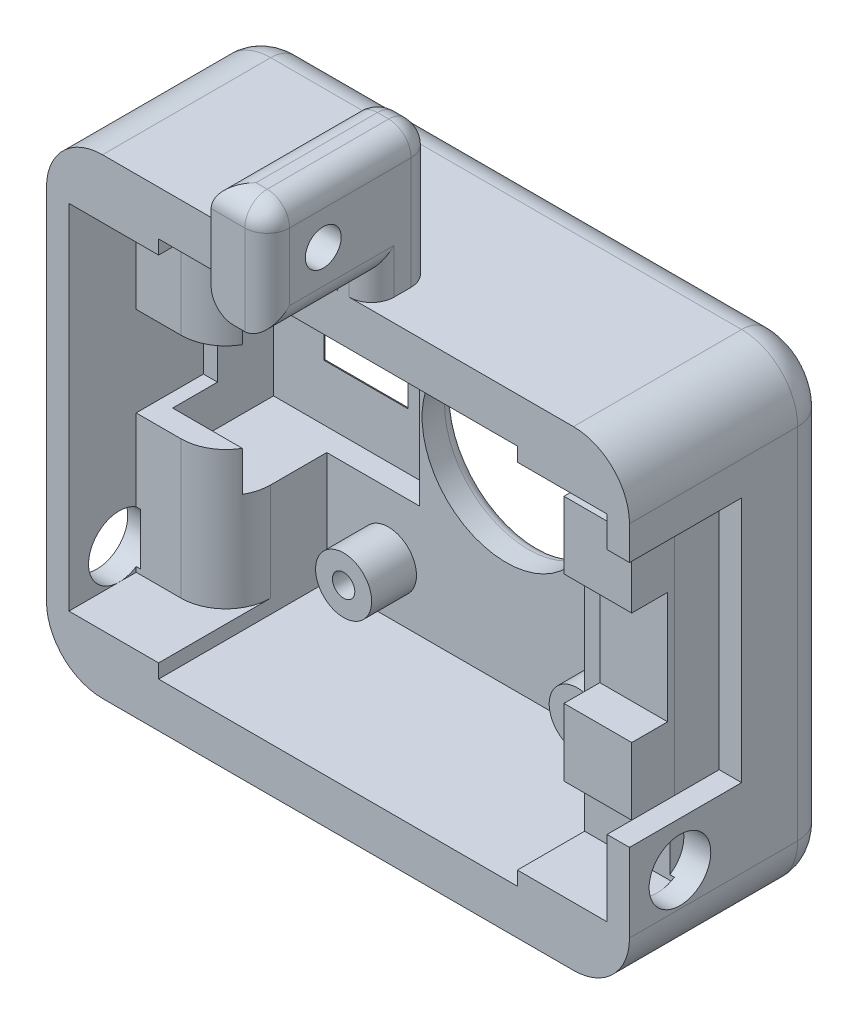
from build123d import *

# Parameters (mm, degrees)
SKETCH1_W               = 52
SKETCH1_H               = 42
BOSS_EXTRUDE1_DEPTH     = 10
SKETCH2_W               = 48
SKETCH2_H               = 31.5
CUT_EXTRUDE1_DEPTH      = 6
SKETCH6_W               = 52
SKETCH6_H               = 42
BOSS_EXTRUDE2_DEPTH     = 8
CUT_EXTRUDE5_DEPTH      = 36.510561809
CUT_EXTRUDE5_DEPTH_BACK = 9
SKETCH5_W               = 32
SKETCH5_H               = 34
CUT_EXTRUDE4_REACH      = 38.633
SKETCH7_R               = 7.5
FILLET2_R               = 1
FILLET3_R               = 3
FILLET4_R               = 5
SKETCH8_W               = 2
SKETCH8_H               = 22
CUT_EXTRUDE6_DEPTH      = 10
SKETCH11_W              = 6.046016102
SKETCH11_H              = 22
BOSS_EXTRUDE9_DEPTH     = 3.8
SKETCH12_W              = 7.5
SKETCH12_H              = 10
CUT_EXTRUDE8_DEPTH      = 3.2
FILLET9_R               = 4
SKETCH13_R              = 2.75
CUT_EXTRUDE9_DEPTH      = 2.4
CUT_EXTRUDE10_START     = -2.4
SKETCH14_R              = 2.75
CUT_EXTRUDE10_DEPTH     = 2.4
SKETCH18_W              = 15
SKETCH18_H              = 14
CUT_EXTRUDE15_DEPTH     = 9
SKETCH19_W              = 7.5
SKETCH19_H              = 4
CUT_EXTRUDE16_DEPTH     = 1
SKETCH21_W              = 5
SKETCH21_H              = 5.520077182
BOSS_EXTRUDE10_DEPTH    = 2
SKETCH27_W              = 5
SKETCH27_H              = 14.834345629
BOSS_EXTRUDE13_DEPTH    = 10
SKETCH28_R              = 1.6
CUT_EXTRUDE19_DEPTH     = 48.392414643
FILLET14_R              = 2
FILLET13_R              = 2
SKETCH25_R              = 2.5
BOSS_EXTRUDE12_DEPTH    = 4
SKETCH26_R              = 1
CUT_EXTRUDE18_DEPTH     = 4
SKETCH29_W              = 8
SKETCH29_H              = 8
CUT_EXTRUDE20_DEPTH     = 6
SKETCH30_W              = 26
SKETCH30_H              = 9
CUT_EXTRUDE21_DEPTH     = 2
CHAMFER1_SIZE           = 1


with BuildPart() as part:
    # Sketch1 → Boss-Extrude1 (new body)
    with BuildSketch(Plane.XY):
        Rectangle(SKETCH1_W, SKETCH1_H)
    extrude(amount=BOSS_EXTRUDE1_DEPTH)

    # Sketch2 → Cut-Extrude1 (cut)
    with BuildSketch(Plane.XY.offset(10)):
        Rectangle(SKETCH2_W, SKETCH2_H)
    extrude(amount=-CUT_EXTRUDE1_DEPTH, mode=Mode.SUBTRACT)

    # Sketch6 → Boss-Extrude2 (add)
    with BuildSketch(Plane(origin=(0, 0, 0), x_dir=(-1, 0, 0), z_dir=(0, 0, -1))):
        Rectangle(SKETCH6_W, SKETCH6_H)
    extrude(amount=BOSS_EXTRUDE2_DEPTH)

    # Sketch5 → Cut-Extrude5 (cut, two sides: drawn at the far end of the back side and taken through both)
    with BuildSketch(Plane.XY.offset(4).offset(-CUT_EXTRUDE5_DEPTH_BACK)):
        Rectangle(SKETCH5_W, SKETCH5_H)
    extrude(amount=CUT_EXTRUDE5_DEPTH + CUT_EXTRUDE5_DEPTH_BACK, mode=Mode.SUBTRACT)

    # Sketch7 → Cut-Extrude4 (cut, up to next)
    with BuildSketch(Plane.XY.offset(-5), mode=Mode.PRIVATE) as cut_extrude4_sk1:
        Circle(SKETCH7_R)
    cut_extrude4_tool1 = extrude(cut_extrude4_sk1.sketch, amount=-CUT_EXTRUDE4_REACH, mode=Mode.PRIVATE) & part.part
    add(cut_extrude4_tool1.solids().sort_by_distance((0, 0, -5))[0], mode=Mode.SUBTRACT)

    # Fillet2
    fillet2_edges = [part.edges().sort_by_distance(p)[0] for p in [
        (-7.5, 0, -8),
    ]]
    fillet(fillet2_edges, radius=FILLET2_R)

    # Fillet3
    fillet3_edges = [part.edges().sort_by_distance(p)[0] for p in [
        (-26, 0, -8),
        (0, 21, -8),
        (26, 0, -8),
        (0, -21, -8),
    ]]
    fillet(fillet3_edges, radius=FILLET3_R)

    # Fillet4
    # the kernel refuses this fillet: 5 mm, written as the material it takes off along each edge
    with BuildSketch(Plane(origin=(21, 16, -8), x_dir=(0, 1, 0), z_dir=(-1, 0, 0))) as fillet4_piece_1:
        with BuildLine():
            CenterArc((2, -3), 3, 0, 90)
            Line((5, -3), (5, 0))
            Line((5, 0), (2, 0))
        make_face()
    revolve(axis=Axis((21, 16, -8), (0, 0, -1)), revolution_arc=90, mode=Mode.SUBTRACT)
    with BuildSketch(Plane(origin=(-21, 16, -8), x_dir=(-1, 0, 0), z_dir=(0, -1, 0))) as fillet4_piece_2:
        with BuildLine():
            CenterArc((2, -3), 3, 0, 90)
            Line((5, -3), (5, 0))
            Line((5, 0), (2, 0))
        make_face()
    revolve(axis=Axis((-21, 16, -8), (0, 0, -1)), revolution_arc=90, mode=Mode.SUBTRACT)
    with BuildSketch(Plane(origin=(21, -16, -8), x_dir=(1, 0, 0), z_dir=(0, 1, 0))) as fillet4_piece_3:
        with BuildLine():
            CenterArc((2, -3), 3, 0, 90)
            Line((5, -3), (5, 0))
            Line((5, 0), (2, 0))
        make_face()
    revolve(axis=Axis((21, -16, -8), (0, 0, -1)), revolution_arc=90, mode=Mode.SUBTRACT)
    with BuildSketch(Plane(origin=(-21, -16, -8), x_dir=(0, -1, 0), z_dir=(1, 0, 0))) as fillet4_piece_4:
        with BuildLine():
            CenterArc((2, -3), 3, 0, 90)
            Line((5, -3), (5, 0))
            Line((5, 0), (2, 0))
        make_face()
    revolve(axis=Axis((-21, -16, -8), (0, 0, -1)), revolution_arc=90, mode=Mode.SUBTRACT)
    with BuildSketch(Plane(origin=(-26, 21, -8), x_dir=(0, -1, 0), z_dir=(0, 0, 1)), Plane(origin=(26, -21, 22.5), x_dir=(-1, 0, 0), z_dir=(0, 0, -1))) as fillet4_piece_5:
        with BuildLine():
            CenterArc((FILLET4_R, FILLET4_R), FILLET4_R, 180, 90)
            Line((0, FILLET4_R), (0, 0))
            Line((0, 0), (FILLET4_R, 0))
        make_face()
    extrude(amount=30.5, mode=Mode.SUBTRACT)
    with BuildSketch(Plane(origin=(-26, -21, -8), x_dir=(0, 1, 0), z_dir=(0, 0, 1)), Plane(origin=(26, 21, 22.5), x_dir=(-1, 0, 0), z_dir=(0, 0, -1))) as fillet4_piece_6:
        with BuildLine():
            CenterArc((FILLET4_R, -FILLET4_R), FILLET4_R, 90, 90)
            Line((0, -FILLET4_R), (0, 0))
            Line((0, 0), (FILLET4_R, 0))
        make_face()
    extrude(amount=30.5, mode=Mode.SUBTRACT)

    # Sketch8 → Cut-Extrude6 (cut)
    with BuildSketch(Plane.XY.offset(10)):
        with Locations((25, 2)):
            Rectangle(SKETCH8_W, SKETCH8_H)
    extrude(amount=-CUT_EXTRUDE6_DEPTH, mode=Mode.SUBTRACT)

    # Fillet9
    fillet9_edges = [part.edges().sort_by_distance(p)[0] for p in [
        (-16, 0, 4),
    ]]
    fillet(fillet9_edges, radius=FILLET9_R)

    # Sketch13 → Cut-Extrude9 (cut)
    with BuildSketch(Plane(origin=(26, 0, 0), x_dir=(0, 0, -1), z_dir=(1, 0, 0))):
        with Locations(Location((-5.5, -13, 0), (0, 0, 90))):
            Circle(SKETCH13_R)
    extrude(amount=-CUT_EXTRUDE9_DEPTH, mode=Mode.SUBTRACT)

    # Sketch14 → Cut-Extrude10 (cut)
    with BuildSketch(Plane.ZY.offset(26).offset(CUT_EXTRUDE10_START)):
        with Locations(Location((5.5, -13, 0), (0, 0, 90))):
            Circle(SKETCH14_R)
    extrude(amount=CUT_EXTRUDE10_DEPTH, mode=Mode.SUBTRACT)

    # Sketch18 → Cut-Extrude15 (cut)
    with BuildSketch(Plane(origin=(0, 0, 2), x_dir=(-1, 0, 0), z_dir=(0, 0, -1))):
        with Locations((-15.25, 0)):
            Rectangle(SKETCH18_W, SKETCH18_H)
        with Locations((15.25, 0)):
            Rectangle(SKETCH18_W, SKETCH18_H)
    extrude(amount=CUT_EXTRUDE15_DEPTH, mode=Mode.SUBTRACT)

    # Sketch19 → Cut-Extrude16 (cut)
    with BuildSketch(Plane.XY.offset(-7)):
        with Locations((14.5, 0)):
            Rectangle(SKETCH19_W, SKETCH19_H)
        with Locations((-14.5, 0)):
            Rectangle(SKETCH19_W, SKETCH19_H)
    extrude(amount=-CUT_EXTRUDE16_DEPTH, mode=Mode.SUBTRACT)

    # Sketch21 → Boss-Extrude10 (add)
    with BuildSketch(Plane(origin=(0, 21, 0), x_dir=(1, 0, 0), z_dir=(0, 1, 0))):
        with Locations((0.5, -7.239961409)):
            Rectangle(SKETCH21_W, SKETCH21_H)
    extrude(amount=BOSS_EXTRUDE10_DEPTH)

    # Sketch27 → Boss-Extrude13 (add)
    with BuildSketch(Plane(origin=(0, 23, 0), x_dir=(1, 0, 0), z_dir=(0, 1, 0))):
        with Locations((0.5, -11.897095633)):
            Rectangle(SKETCH27_W, SKETCH27_H)
    extrude(amount=BOSS_EXTRUDE13_DEPTH)

    # Sketch28 → Cut-Extrude19 (cut, through all)
    with BuildSketch(Plane.ZY.offset(2)):
        with Locations((14.314268447, 28)):
            Circle(SKETCH28_R)
    extrude(amount=-CUT_EXTRUDE19_DEPTH, mode=Mode.SUBTRACT)

    # Fillet14
    fillet14_edges = [part.edges().sort_by_distance(p)[0] for p in [
        (-2, 27, 4.479922818),
        (-2, 22, 10),
        (3, 22, 10),
        (3, 27, 4.479922818),
        (-2, 23, 14.657134224),
        (3, 23, 14.657134224),
        (3, 28, 19.314268447),
        (-2, 33, 11.897095633),
        (0.5, 33, 19.314268447),
        (3, 33, 11.897095633),
        (0.5, 33, 4.479922818),
    ]]
    fillet(fillet14_edges, radius=FILLET14_R)

    # Fillet13
    # the kernel refuses this fillet: 2 mm, written as the material it takes off along each edge
    with BuildSketch(Plane(origin=(-18.25, -2, -8), x_dir=(-1, 0, 0), z_dir=(0, 1, 0)), Plane(origin=(-10.75, 2, -8), x_dir=(1, 0, 0), z_dir=(0, -1, 0)), Plane(origin=(10.75, -2, -8), x_dir=(-1, 0, 0), z_dir=(0, 1, 0)), Plane(origin=(18.25, 2, -8), x_dir=(1, 0, 0), z_dir=(0, -1, 0))) as fillet13_piece_1:
        with BuildLine():
            CenterArc((1.732050808, 2), FILLET13_R, 210, 60)
            Line((0, 1), (-0.034641016, 0.98))
            ThreePointArc((-0.034641016, 0.98), (-0.04, 0.5), (-0.04, 0))
            Line((-0.04, 0), (0, -0.04))
            Line((0, -0.04), (1.732050808, -0.04))
            Line((1.732050808, -0.04), (1.732050808, 0))
        make_face()
    extrude(amount=4, mode=Mode.SUBTRACT)
    with BuildSketch(Plane(origin=(-10.75, -2, -8), x_dir=(0, -1, 0), z_dir=(-1, 0, 0)), Plane(origin=(-18.25, 2, -8), x_dir=(0, 1, 0), z_dir=(1, 0, 0)), Plane(origin=(18.25, -2, -8), x_dir=(0, -1, 0), z_dir=(-1, 0, 0)), Plane(origin=(10.75, 2, -8), x_dir=(0, 1, 0), z_dir=(1, 0, 0))) as fillet13_piece_2:
        with BuildLine():
            CenterArc((1.732050808, 2), FILLET13_R, 210, 60)
            Line((0, 1), (-0.034641016, 0.98))
            ThreePointArc((-0.034641016, 0.98), (-0.04, 0.5), (-0.04, 0))
            Line((-0.04, 0), (0, -0.04))
            Line((0, -0.04), (1.732050808, -0.04))
            Line((1.732050808, -0.04), (1.732050808, 0))
        make_face()
    extrude(amount=7.5, mode=Mode.SUBTRACT)
    with BuildSketch(Plane(origin=(-18.25, -6.330127019, -8), x_dir=(-1, 0, 0), z_dir=(0, 1, 0))) as fillet13_piece_3a_section:
        with BuildLine():
            CenterArc((1.732050808, 2), FILLET13_R, 210, 60)
            Line((0, 1), (-0.034641016, 0.98))
            ThreePointArc((-0.034641016, 0.98), (-0.04, 0.5), (-0.04, 0))
            Line((-0.04, 0), (0, -0.04))
            Line((0, -0.04), (1.732050808, -0.04))
            Line((1.732050808, -0.04), (1.732050808, 0))
        make_face()
    fillet13_piece_3a = extrude(amount=8.330127019, mode=Mode.PRIVATE)
    fillet13_piece_3a = split(fillet13_piece_3a, bisect_by=Plane(origin=(-18.682620892, -2, -7.740966578), z_dir=(0, -1, 0)), keep=Keep.TOP, mode=Mode.PRIVATE)
    with BuildSketch(Plane(origin=(-10.75, -2, -8), x_dir=(0, -1, 0), z_dir=(-1, 0, 0))) as fillet13_piece_3b_section:
        with BuildLine():
            CenterArc((1.732050808, 2), FILLET13_R, 210, 60)
            Line((0, 1), (-0.034641016, 0.98))
            ThreePointArc((-0.034641016, 0.98), (-0.04, 0.5), (-0.04, 0))
            Line((-0.04, 0), (0, -0.04))
            Line((0, -0.04), (1.732050808, -0.04))
            Line((1.732050808, -0.04), (1.732050808, 0))
        make_face()
    fillet13_piece_3b = extrude(amount=11.830127019, mode=Mode.PRIVATE)
    fillet13_piece_3b = split(fillet13_piece_3b, bisect_by=Plane(origin=(-18.25, -2.432620892, -7.740966578), z_dir=(-1, 0, 0)), keep=Keep.TOP, mode=Mode.PRIVATE)
    fillet13_piece_3 = fillet13_piece_3a & fillet13_piece_3b
    add(fillet13_piece_3, mode=Mode.SUBTRACT)
    with BuildSketch(Plane(origin=(-18.25, -2, -8), x_dir=(-1, 0, 0), z_dir=(0, 1, 0))) as fillet13_piece_4a_section:
        with BuildLine():
            CenterArc((1.732050808, 2), FILLET13_R, 210, 60)
            Line((0, 1), (-0.034641016, 0.98))
            ThreePointArc((-0.034641016, 0.98), (-0.04, 0.5), (-0.04, 0))
            Line((-0.04, 0), (0, -0.04))
            Line((0, -0.04), (1.732050808, -0.04))
            Line((1.732050808, -0.04), (1.732050808, 0))
        make_face()
    fillet13_piece_4a = extrude(amount=8.330127019, mode=Mode.PRIVATE)
    fillet13_piece_4a = split(fillet13_piece_4a, bisect_by=Plane(origin=(-18.682620892, 2, -7.740966578), z_dir=(0, 1, 0)), keep=Keep.TOP, mode=Mode.PRIVATE)
    with BuildSketch(Plane(origin=(-22.580127019, 2, -8), x_dir=(0, 1, 0), z_dir=(1, 0, 0))) as fillet13_piece_4b_section:
        with BuildLine():
            CenterArc((1.732050808, 2), FILLET13_R, 210, 60)
            Line((0, 1), (-0.034641016, 0.98))
            ThreePointArc((-0.034641016, 0.98), (-0.04, 0.5), (-0.04, 0))
            Line((-0.04, 0), (0, -0.04))
            Line((0, -0.04), (1.732050808, -0.04))
            Line((1.732050808, -0.04), (1.732050808, 0))
        make_face()
    fillet13_piece_4b = extrude(amount=11.830127019, mode=Mode.PRIVATE)
    fillet13_piece_4b = split(fillet13_piece_4b, bisect_by=Plane(origin=(-18.25, 2.432620892, -7.740966578), z_dir=(-1, 0, 0)), keep=Keep.TOP, mode=Mode.PRIVATE)
    fillet13_piece_4 = fillet13_piece_4a & fillet13_piece_4b
    add(fillet13_piece_4, mode=Mode.SUBTRACT)
    with BuildSketch(Plane(origin=(-10.75, 6.330127019, -8), x_dir=(1, 0, 0), z_dir=(0, -1, 0))) as fillet13_piece_5a_section:
        with BuildLine():
            CenterArc((1.732050808, 2), FILLET13_R, 210, 60)
            Line((0, 1), (-0.034641016, 0.98))
            ThreePointArc((-0.034641016, 0.98), (-0.04, 0.5), (-0.04, 0))
            Line((-0.04, 0), (0, -0.04))
            Line((0, -0.04), (1.732050808, -0.04))
            Line((1.732050808, -0.04), (1.732050808, 0))
        make_face()
    fillet13_piece_5a = extrude(amount=8.330127019, mode=Mode.PRIVATE)
    fillet13_piece_5a = split(fillet13_piece_5a, bisect_by=Plane(origin=(-10.317379108, 2, -7.740966578), z_dir=(0, 1, 0)), keep=Keep.TOP, mode=Mode.PRIVATE)
    with BuildSketch(Plane(origin=(-18.25, 2, -8), x_dir=(0, 1, 0), z_dir=(1, 0, 0))) as fillet13_piece_5b_section:
        with BuildLine():
            CenterArc((1.732050808, 2), FILLET13_R, 210, 60)
            Line((0, 1), (-0.034641016, 0.98))
            ThreePointArc((-0.034641016, 0.98), (-0.04, 0.5), (-0.04, 0))
            Line((-0.04, 0), (0, -0.04))
            Line((0, -0.04), (1.732050808, -0.04))
            Line((1.732050808, -0.04), (1.732050808, 0))
        make_face()
    fillet13_piece_5b = extrude(amount=11.830127019, mode=Mode.PRIVATE)
    fillet13_piece_5b = split(fillet13_piece_5b, bisect_by=Plane(origin=(-10.75, 2.432620892, -7.740966578), z_dir=(1, 0, 0)), keep=Keep.TOP, mode=Mode.PRIVATE)
    fillet13_piece_5 = fillet13_piece_5a & fillet13_piece_5b
    add(fillet13_piece_5, mode=Mode.SUBTRACT)
    with BuildSketch(Plane(origin=(-6.419872981, -2, -8), x_dir=(0, -1, 0), z_dir=(-1, 0, 0))) as fillet13_piece_6a_section:
        with BuildLine():
            CenterArc((1.732050808, 2), FILLET13_R, 210, 60)
            Line((0, 1), (-0.034641016, 0.98))
            ThreePointArc((-0.034641016, 0.98), (-0.04, 0.5), (-0.04, 0))
            Line((-0.04, 0), (0, -0.04))
            Line((0, -0.04), (1.732050808, -0.04))
            Line((1.732050808, -0.04), (1.732050808, 0))
        make_face()
    fillet13_piece_6a = extrude(amount=11.830127019, mode=Mode.PRIVATE)
    fillet13_piece_6a = split(fillet13_piece_6a, bisect_by=Plane(origin=(-10.75, -2.432620892, -7.740966578), z_dir=(1, 0, 0)), keep=Keep.TOP, mode=Mode.PRIVATE)
    with BuildSketch(Plane(origin=(-10.75, 2, -8), x_dir=(1, 0, 0), z_dir=(0, -1, 0))) as fillet13_piece_6b_section:
        with BuildLine():
            CenterArc((1.732050808, 2), FILLET13_R, 210, 60)
            Line((0, 1), (-0.034641016, 0.98))
            ThreePointArc((-0.034641016, 0.98), (-0.04, 0.5), (-0.04, 0))
            Line((-0.04, 0), (0, -0.04))
            Line((0, -0.04), (1.732050808, -0.04))
            Line((1.732050808, -0.04), (1.732050808, 0))
        make_face()
    fillet13_piece_6b = extrude(amount=8.330127019, mode=Mode.PRIVATE)
    fillet13_piece_6b = split(fillet13_piece_6b, bisect_by=Plane(origin=(-10.317379108, -2, -7.740966578), z_dir=(0, -1, 0)), keep=Keep.TOP, mode=Mode.PRIVATE)
    fillet13_piece_6 = fillet13_piece_6a & fillet13_piece_6b
    add(fillet13_piece_6, mode=Mode.SUBTRACT)
    with BuildSketch(Plane(origin=(10.75, -6.330127019, -8), x_dir=(-1, 0, 0), z_dir=(0, 1, 0))) as fillet13_piece_7a_section:
        with BuildLine():
            CenterArc((1.732050808, 2), FILLET13_R, 210, 60)
            Line((0, 1), (-0.034641016, 0.98))
            ThreePointArc((-0.034641016, 0.98), (-0.04, 0.5), (-0.04, 0))
            Line((-0.04, 0), (0, -0.04))
            Line((0, -0.04), (1.732050808, -0.04))
            Line((1.732050808, -0.04), (1.732050808, 0))
        make_face()
    fillet13_piece_7a = extrude(amount=8.330127019, mode=Mode.PRIVATE)
    fillet13_piece_7a = split(fillet13_piece_7a, bisect_by=Plane(origin=(10.317379108, -2, -7.740966578), z_dir=(0, -1, 0)), keep=Keep.TOP, mode=Mode.PRIVATE)
    with BuildSketch(Plane(origin=(18.25, -2, -8), x_dir=(0, -1, 0), z_dir=(-1, 0, 0))) as fillet13_piece_7b_section:
        with BuildLine():
            CenterArc((1.732050808, 2), FILLET13_R, 210, 60)
            Line((0, 1), (-0.034641016, 0.98))
            ThreePointArc((-0.034641016, 0.98), (-0.04, 0.5), (-0.04, 0))
            Line((-0.04, 0), (0, -0.04))
            Line((0, -0.04), (1.732050808, -0.04))
            Line((1.732050808, -0.04), (1.732050808, 0))
        make_face()
    fillet13_piece_7b = extrude(amount=11.830127019, mode=Mode.PRIVATE)
    fillet13_piece_7b = split(fillet13_piece_7b, bisect_by=Plane(origin=(10.75, -2.432620892, -7.740966578), z_dir=(-1, 0, 0)), keep=Keep.TOP, mode=Mode.PRIVATE)
    fillet13_piece_7 = fillet13_piece_7a & fillet13_piece_7b
    add(fillet13_piece_7, mode=Mode.SUBTRACT)
    with BuildSketch(Plane(origin=(10.75, -2, -8), x_dir=(-1, 0, 0), z_dir=(0, 1, 0))) as fillet13_piece_8a_section:
        with BuildLine():
            CenterArc((1.732050808, 2), FILLET13_R, 210, 60)
            Line((0, 1), (-0.034641016, 0.98))
            ThreePointArc((-0.034641016, 0.98), (-0.04, 0.5), (-0.04, 0))
            Line((-0.04, 0), (0, -0.04))
            Line((0, -0.04), (1.732050808, -0.04))
            Line((1.732050808, -0.04), (1.732050808, 0))
        make_face()
    fillet13_piece_8a = extrude(amount=8.330127019, mode=Mode.PRIVATE)
    fillet13_piece_8a = split(fillet13_piece_8a, bisect_by=Plane(origin=(10.317379108, 2, -7.740966578), z_dir=(0, 1, 0)), keep=Keep.TOP, mode=Mode.PRIVATE)
    with BuildSketch(Plane(origin=(6.419872981, 2, -8), x_dir=(0, 1, 0), z_dir=(1, 0, 0))) as fillet13_piece_8b_section:
        with BuildLine():
            CenterArc((1.732050808, 2), FILLET13_R, 210, 60)
            Line((0, 1), (-0.034641016, 0.98))
            ThreePointArc((-0.034641016, 0.98), (-0.04, 0.5), (-0.04, 0))
            Line((-0.04, 0), (0, -0.04))
            Line((0, -0.04), (1.732050808, -0.04))
            Line((1.732050808, -0.04), (1.732050808, 0))
        make_face()
    fillet13_piece_8b = extrude(amount=11.830127019, mode=Mode.PRIVATE)
    fillet13_piece_8b = split(fillet13_piece_8b, bisect_by=Plane(origin=(10.75, 2.432620892, -7.740966578), z_dir=(-1, 0, 0)), keep=Keep.TOP, mode=Mode.PRIVATE)
    fillet13_piece_8 = fillet13_piece_8a & fillet13_piece_8b
    add(fillet13_piece_8, mode=Mode.SUBTRACT)
    with BuildSketch(Plane(origin=(18.25, 6.330127019, -8), x_dir=(1, 0, 0), z_dir=(0, -1, 0))) as fillet13_piece_9a_section:
        with BuildLine():
            CenterArc((1.732050808, 2), FILLET13_R, 210, 60)
            Line((0, 1), (-0.034641016, 0.98))
            ThreePointArc((-0.034641016, 0.98), (-0.04, 0.5), (-0.04, 0))
            Line((-0.04, 0), (0, -0.04))
            Line((0, -0.04), (1.732050808, -0.04))
            Line((1.732050808, -0.04), (1.732050808, 0))
        make_face()
    fillet13_piece_9a = extrude(amount=8.330127019, mode=Mode.PRIVATE)
    fillet13_piece_9a = split(fillet13_piece_9a, bisect_by=Plane(origin=(18.682620892, 2, -7.740966578), z_dir=(0, 1, 0)), keep=Keep.TOP, mode=Mode.PRIVATE)
    with BuildSketch(Plane(origin=(10.75, 2, -8), x_dir=(0, 1, 0), z_dir=(1, 0, 0))) as fillet13_piece_9b_section:
        with BuildLine():
            CenterArc((1.732050808, 2), FILLET13_R, 210, 60)
            Line((0, 1), (-0.034641016, 0.98))
            ThreePointArc((-0.034641016, 0.98), (-0.04, 0.5), (-0.04, 0))
            Line((-0.04, 0), (0, -0.04))
            Line((0, -0.04), (1.732050808, -0.04))
            Line((1.732050808, -0.04), (1.732050808, 0))
        make_face()
    fillet13_piece_9b = extrude(amount=11.830127019, mode=Mode.PRIVATE)
    fillet13_piece_9b = split(fillet13_piece_9b, bisect_by=Plane(origin=(18.25, 2.432620892, -7.740966578), z_dir=(1, 0, 0)), keep=Keep.TOP, mode=Mode.PRIVATE)
    fillet13_piece_9 = fillet13_piece_9a & fillet13_piece_9b
    add(fillet13_piece_9, mode=Mode.SUBTRACT)
    with BuildSketch(Plane(origin=(22.580127019, -2, -8), x_dir=(0, -1, 0), z_dir=(-1, 0, 0))) as fillet13_piece_10a_section:
        with BuildLine():
            CenterArc((1.732050808, 2), FILLET13_R, 210, 60)
            Line((0, 1), (-0.034641016, 0.98))
            ThreePointArc((-0.034641016, 0.98), (-0.04, 0.5), (-0.04, 0))
            Line((-0.04, 0), (0, -0.04))
            Line((0, -0.04), (1.732050808, -0.04))
            Line((1.732050808, -0.04), (1.732050808, 0))
        make_face()
    fillet13_piece_10a = extrude(amount=11.830127019, mode=Mode.PRIVATE)
    fillet13_piece_10a = split(fillet13_piece_10a, bisect_by=Plane(origin=(18.25, -2.432620892, -7.740966578), z_dir=(1, 0, 0)), keep=Keep.TOP, mode=Mode.PRIVATE)
    with BuildSketch(Plane(origin=(18.25, 2, -8), x_dir=(1, 0, 0), z_dir=(0, -1, 0))) as fillet13_piece_10b_section:
        with BuildLine():
            CenterArc((1.732050808, 2), FILLET13_R, 210, 60)
            Line((0, 1), (-0.034641016, 0.98))
            ThreePointArc((-0.034641016, 0.98), (-0.04, 0.5), (-0.04, 0))
            Line((-0.04, 0), (0, -0.04))
            Line((0, -0.04), (1.732050808, -0.04))
            Line((1.732050808, -0.04), (1.732050808, 0))
        make_face()
    fillet13_piece_10b = extrude(amount=8.330127019, mode=Mode.PRIVATE)
    fillet13_piece_10b = split(fillet13_piece_10b, bisect_by=Plane(origin=(18.682620892, -2, -7.740966578), z_dir=(0, -1, 0)), keep=Keep.TOP, mode=Mode.PRIVATE)
    fillet13_piece_10 = fillet13_piece_10a & fillet13_piece_10b
    add(fillet13_piece_10, mode=Mode.SUBTRACT)

    # Sketch25 → Boss-Extrude12 (add)
    with BuildSketch(Plane.XY.offset(-5)):
        with Locations((-10.5, 12.5)):
            Circle(SKETCH25_R)
        with Locations((10.5, 12.5)):
            Circle(SKETCH25_R)
        with Locations((-10.5, -12.5)):
            Circle(SKETCH25_R)
        with Locations((10.337570801, -12.5)):
            Circle(SKETCH25_R)
    extrude(amount=BOSS_EXTRUDE12_DEPTH)

    # Sketch26 → Cut-Extrude18 (cut)
    with BuildSketch(Plane.XY.offset(-1)):
        with Locations((-10.5, 12.5)):
            Circle(SKETCH26_R)
        with Locations((10.5, 12.5)):
            Circle(SKETCH26_R)
        with Locations((-10.5, -12.5)):
            Circle(SKETCH26_R)
        with Locations((10.337570801, -12.5)):
            Circle(SKETCH26_R)
    extrude(amount=-CUT_EXTRUDE18_DEPTH, mode=Mode.SUBTRACT)

    # Sketch29 → Cut-Extrude20 (cut)
    with BuildSketch(Plane.XY.offset(4)):
        with Locations((-20, 0.559960549)):
            Rectangle(SKETCH29_W, SKETCH29_H)
    extrude(amount=-CUT_EXTRUDE20_DEPTH, mode=Mode.SUBTRACT)

    # Sketch30 → Cut-Extrude21 (cut)
    with BuildSketch(Plane.XZ.offset(-17)):
        with Locations((0, -0.436114316)):
            Rectangle(SKETCH30_W, SKETCH30_H)
    extrude(amount=-CUT_EXTRUDE21_DEPTH, mode=Mode.SUBTRACT)

    # Chamfer1
    chamfer1_edges = [part.edges().sort_by_distance(p)[0] for p in [
        (-13, 17, -0.436114316),
        (13, 17, -0.436114316),
    ]]
    chamfer(chamfer1_edges, length=CHAMFER1_SIZE)


with BuildPart() as body_2:
    # Sketch11 → Boss-Extrude9 (new body)
    with BuildSketch(Plane.XY.offset(4)):
        with Locations((20.976991949, 2)):
            Rectangle(SKETCH11_W, SKETCH11_H)
    extrude(amount=BOSS_EXTRUDE9_DEPTH)

    # Sketch12 → Cut-Extrude8 (cut)
    with BuildSketch(Plane.XY.offset(7.8)):
        with Locations((20.25, 2)):
            Rectangle(SKETCH12_W, SKETCH12_H)
    extrude(amount=-CUT_EXTRUDE8_DEPTH, mode=Mode.SUBTRACT)


solid = Compound([part.part, body_2.part])
